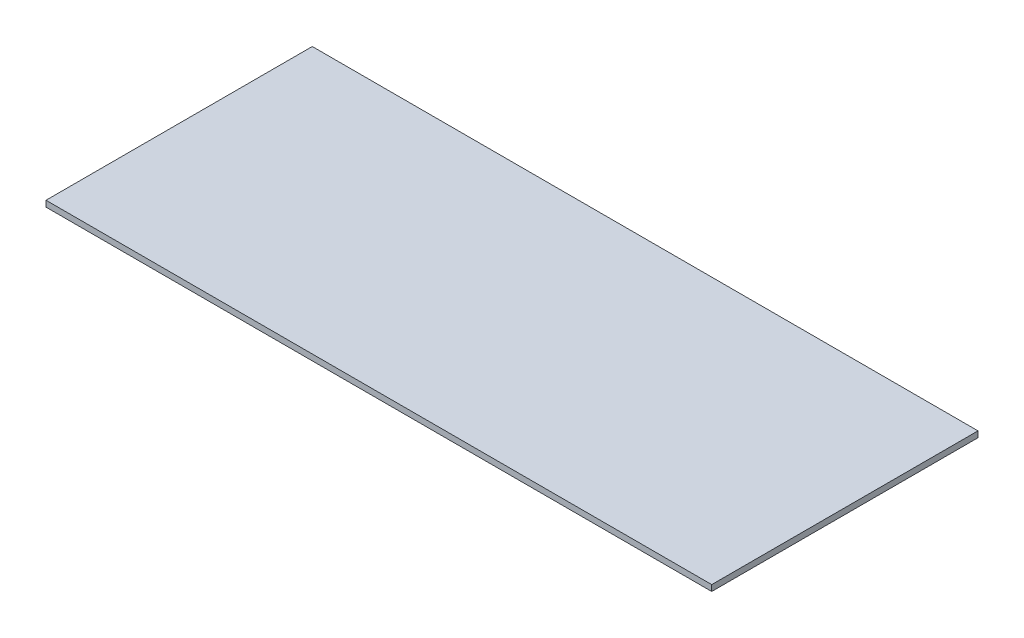
from build123d import *

# Parameters (mm, degrees)
SKETCH1_W           = 2000
SKETCH1_H           = 800
BOSS_EXTRUDE1_DEPTH = 18


with BuildPart() as part:
    # Sketch1 → Boss-Extrude1 (new body)
    with BuildSketch(Plane(origin=(0, 0, 0), x_dir=(1, 0, 0), z_dir=(0, 1, 0))):
        with Locations((1000, 400)):
            Rectangle(SKETCH1_W, SKETCH1_H)
    extrude(amount=BOSS_EXTRUDE1_DEPTH)


solid = part.part
